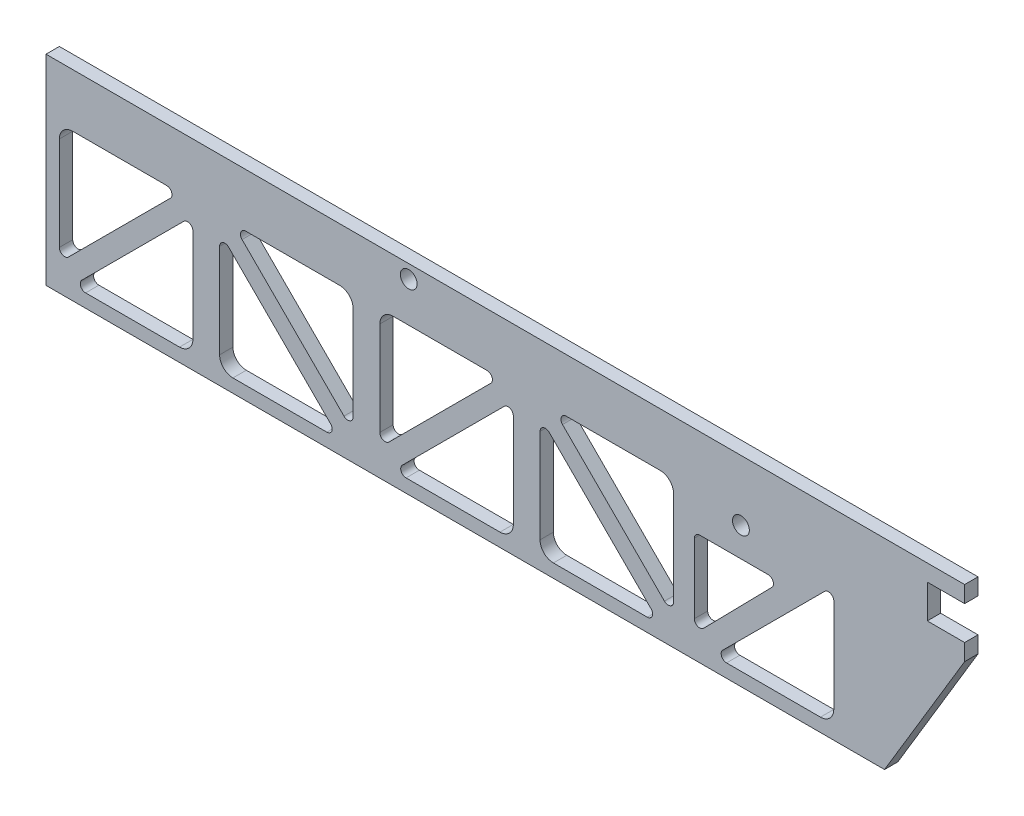
from build123d import *

# Parameters (mm, degrees)
MODEL_R             = 4
BOSS_EXTRUDE2_DEPTH = 6.35


with BuildPart() as part:
    # Model → Boss-Extrude2 (new body)
    with BuildSketch(Plane.XY):
        Polygon((419.1, 87.376), (419.1, 71.374), (436.88, 71.374), (436.88, 63.5), (398.78, 0), (0, 0), (0, 95.25), (436.88, 95.25), (436.88, 87.376), align=None)
        with Locations((172.491700482, 88.801347744)):
            Circle(MODEL_R, mode=Mode.SUBTRACT)
        with Locations((330.479700482, 66.449347744)):
            Circle(MODEL_R, mode=Mode.SUBTRACT)
        with BuildLine():
            Line((312.685453403, 15.123873353), (345.228141797, 48.298807013))
            ThreePointArc((345.228141797, 48.298807013), (345.756846653, 51.060789203), (343.414895332, 52.617496771))
            Line((343.414895332, 52.617496771), (310.872206937, 52.617496771))
            ThreePointArc((310.872206937, 52.617496771), (309.076155713, 51.873547995), (308.332206937, 50.077496771))
            Line((308.332206937, 50.077496771), (308.332206937, 16.902563111))
            ThreePointArc((308.332206937, 16.902563111), (309.911490023, 14.551260704), (312.685453403, 15.123873353))
        make_face(mode=Mode.SUBTRACT)
        with BuildLine():
            Line((171.232102448, 6.35), (215.9, 6.35))
            ThreePointArc((215.9, 6.35), (220.390128061, 8.209871939), (222.25, 12.7))
            Line((222.25, 12.7), (222.25, 57.367897552))
            ThreePointArc((222.25, 57.367897552), (220.682015918, 59.714551565), (217.913948776, 59.163948776))
            Line((217.913948776, 59.163948776), (169.436051224, 10.686051224))
            ThreePointArc((169.436051224, 10.686051224), (168.885448435, 7.917984082), (171.232102448, 6.35))
        make_face(mode=Mode.SUBTRACT)
        with BuildLine():
            Line((234.95, 57.367897552), (234.95, 12.7))
            ThreePointArc((234.95, 12.7), (236.809871939, 8.209871939), (241.3, 6.35))
            Line((241.3, 6.35), (285.967897552, 6.35))
            ThreePointArc((285.967897552, 6.35), (288.314551565, 7.917984082), (287.763948776, 10.686051224))
            Line((287.763948776, 10.686051224), (239.286051224, 59.163948776))
            ThreePointArc((239.286051224, 59.163948776), (236.517984082, 59.714551565), (234.95, 57.367897552))
        make_face(mode=Mode.SUBTRACT)
        with BuildLine():
            Line((294.113948776, 17.036051224), (245.636051224, 65.513948776))
            ThreePointArc((245.636051224, 65.513948776), (245.085448435, 68.282015918), (247.432102448, 69.85))
            Line((247.432102448, 69.85), (292.1, 69.85))
            ThreePointArc((292.1, 69.85), (296.590128061, 67.990128061), (298.45, 63.5))
            Line((298.45, 63.5), (298.45, 18.832102448))
            ThreePointArc((298.45, 18.832102448), (296.882015918, 16.485448435), (294.113948776, 17.036051224))
        make_face(mode=Mode.SUBTRACT)
        with BuildLine():
            Line((323.632102448, 6.35), (368.3, 6.35))
            ThreePointArc((368.3, 6.35), (372.790128061, 8.209871939), (374.65, 12.7))
            Line((374.65, 12.7), (374.65, 57.367897552))
            ThreePointArc((374.65, 57.367897552), (373.082015918, 59.714551565), (370.313948776, 59.163948776))
            Line((370.313948776, 59.163948776), (321.836051224, 10.686051224))
            ThreePointArc((321.836051224, 10.686051224), (321.285448435, 7.917984082), (323.632102448, 6.35))
        make_face(mode=Mode.SUBTRACT)
        with BuildLine():
            Line((18.832102448, 6.35), (63.5, 6.35))
            ThreePointArc((63.5, 6.35), (67.990128061, 8.209871939), (69.85, 12.7))
            Line((69.85, 12.7), (69.85, 57.367897552))
            ThreePointArc((69.85, 57.367897552), (68.282015918, 59.714551565), (65.513948776, 59.163948776))
            Line((65.513948776, 59.163948776), (17.036051224, 10.686051224))
            ThreePointArc((17.036051224, 10.686051224), (16.485448435, 7.917984082), (18.832102448, 6.35))
        make_face(mode=Mode.SUBTRACT)
        with BuildLine():
            Line((82.55, 57.367897552), (82.55, 12.7))
            ThreePointArc((82.55, 12.7), (84.409871939, 8.209871939), (88.9, 6.35))
            Line((88.9, 6.35), (133.567897552, 6.35))
            ThreePointArc((133.567897552, 6.35), (135.914551565, 7.917984082), (135.363948776, 10.686051224))
            Line((135.363948776, 10.686051224), (86.886051224, 59.163948776))
            ThreePointArc((86.886051224, 59.163948776), (84.117984082, 59.714551565), (82.55, 57.367897552))
        make_face(mode=Mode.SUBTRACT)
        with BuildLine():
            Line((93.236051224, 65.513948776), (141.713948776, 17.036051224))
            ThreePointArc((141.713948776, 17.036051224), (144.482015918, 16.485448435), (146.05, 18.832102448))
            Line((146.05, 18.832102448), (146.05, 63.5))
            ThreePointArc((146.05, 63.5), (144.190128061, 67.990128061), (139.7, 69.85))
            Line((139.7, 69.85), (95.032102448, 69.85))
            ThreePointArc((95.032102448, 69.85), (92.685448435, 68.282015918), (93.236051224, 65.513948776))
        make_face(mode=Mode.SUBTRACT)
        with BuildLine():
            Line((163.086051224, 17.036051224), (211.563948776, 65.513948776))
            ThreePointArc((211.563948776, 65.513948776), (212.114551565, 68.282015918), (209.767897552, 69.85))
            Line((209.767897552, 69.85), (165.1, 69.85))
            ThreePointArc((165.1, 69.85), (160.609871939, 67.990128061), (158.75, 63.5))
            Line((158.75, 63.5), (158.75, 18.832102448))
            ThreePointArc((158.75, 18.832102448), (160.317984082, 16.485448435), (163.086051224, 17.036051224))
        make_face(mode=Mode.SUBTRACT)
        with BuildLine():
            Line((6.35, 63.5), (6.35, 18.832102448))
            ThreePointArc((6.35, 18.832102448), (7.917984082, 16.485448435), (10.686051224, 17.036051224))
            Line((10.686051224, 17.036051224), (59.163948776, 65.513948776))
            ThreePointArc((59.163948776, 65.513948776), (59.714551565, 68.282015918), (57.367897552, 69.85))
            Line((57.367897552, 69.85), (12.7, 69.85))
            ThreePointArc((12.7, 69.85), (8.209871939, 67.990128061), (6.35, 63.5))
        make_face(mode=Mode.SUBTRACT)
    extrude(amount=BOSS_EXTRUDE2_DEPTH)


solid = part.part
